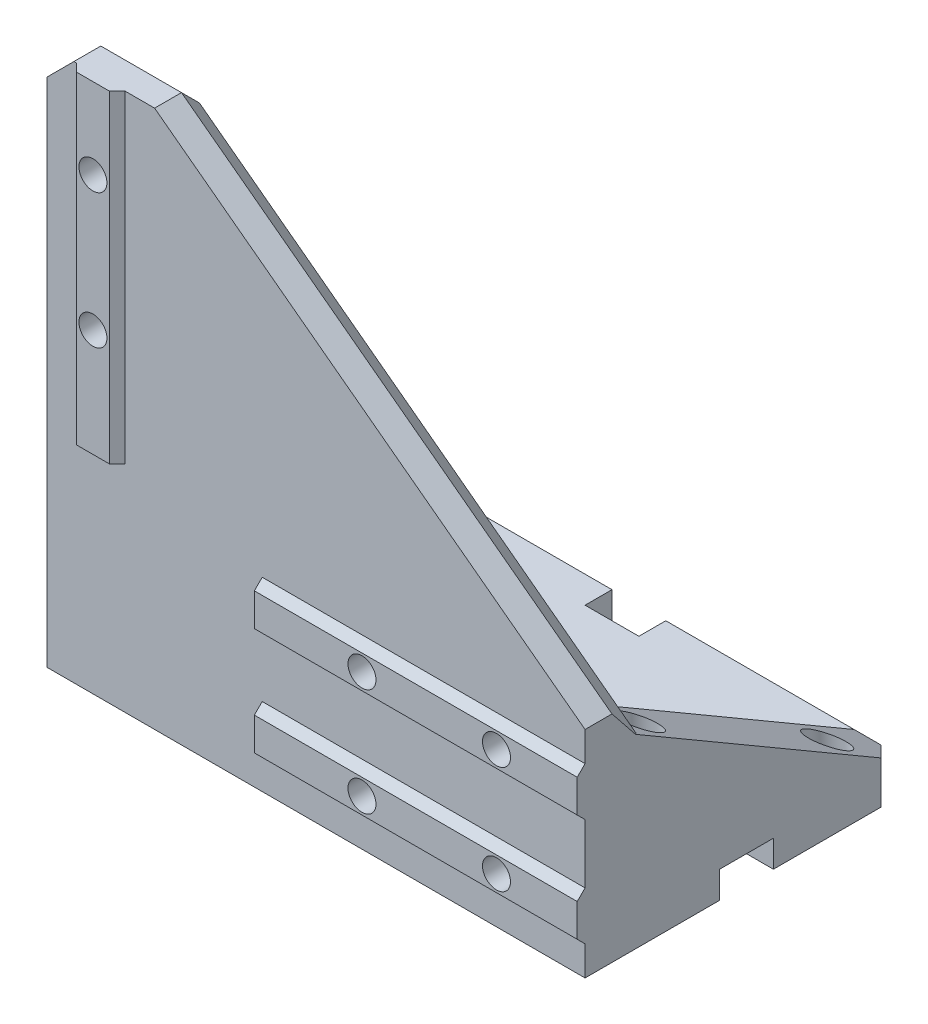
from build123d import *

# Parameters (mm, degrees)
BOSS_EXTRUDE1_DEPTH     = 10
SKETCH2_R               = 2.6
CUT_EXTRUDE1_DEPTH      = 142.774468788
BOSS_EXTRUDE3_START     = 10
SKETCH3_W               = 60
SKETCH3_H               = 9
SKETCH3_W_2             = 9
SKETCH3_H_2             = 60
BOSS_EXTRUDE3_DEPTH     = 1.46
CUT_EXTRUDE2_DEPTH      = 142.884923794
CUT_EXTRUDE2_DEPTH_BACK = 142.884923794
SKETCH2_2_R             = 2.6
CHAMFER1_SIZE           = 1.46
SKETCH4_R               = 4.5
CUT_EXTRUDE3_DEPTH      = 5
SKETCH5_W               = 100
SKETCH5_H               = 50
BOSS_EXTRUDE4_DEPTH     = 5
BOSS_EXTRUDE5_DEPTH     = 10
BOSS_EXTRUDE6_START     = 100
BOSS_EXTRUDE6_DEPTH     = 10
CUT_EXTRUDE4_DEPTH      = 151
CUT_EXTRUDE4_DEPTH_BACK = 151
SKETCH10_R              = 1.75
CUT_EXTRUDE5_START      = 100
SKETCH11_R              = 3.5
CUT_EXTRUDE5_DEPTH      = 95
SKETCH12_W              = 5
SKETCH12_H              = 10
SKETCH12_W_2            = 10
SKETCH12_H_2            = 5
CUT_EXTRUDE6_DEPTH      = 5
CHAMFER2_SIZE           = 5


# Some blends are built 0.0001 mm under size
with BuildPart() as part:
    # Sketch1 → Boss-Extrude1 (new body)
    with BuildSketch(Plane.XY):
        Polygon((0, 0), (100, 0), (100, 40), (20, 100), (0, 100), align=None)
    extrude(amount=BOSS_EXTRUDE1_DEPTH)

    # Sketch2 → Cut-Extrude1 (cut, through all)
    with BuildSketch(Plane.XY):
        with Locations((10, 85)):
            Circle(SKETCH2_R)
        with Locations((10, 60)):
            Circle(SKETCH2_R)
        with Locations((85, 30)):
            Circle(SKETCH2_R)
        with Locations((85, 10)):
            Circle(SKETCH2_R)
        with Locations((60, 10)):
            Circle(SKETCH2_R)
        with Locations((60, 30)):
            Circle(SKETCH2_R)
    extrude(amount=CUT_EXTRUDE1_DEPTH, mode=Mode.SUBTRACT)

    # Sketch3 → Boss-Extrude3 (add)
    with BuildSketch(Plane.XY.offset(BOSS_EXTRUDE3_START)):
        with Locations((70, 30)):
            Rectangle(SKETCH3_W, SKETCH3_H)
        with Locations((70, 10)):
            Rectangle(SKETCH3_W, SKETCH3_H)
        with Locations((10, 70)):
            Rectangle(SKETCH3_W_2, SKETCH3_H_2)
    extrude(amount=BOSS_EXTRUDE3_DEPTH)

    # Sketch2<2> → Cut-Extrude2 (cut, two sides: drawn at the far end of the back side and taken through both)
    with BuildSketch(Plane.XY.offset(-CUT_EXTRUDE2_DEPTH_BACK)):
        with Locations((10, 85)):
            Circle(SKETCH2_2_R)
        with Locations((10, 60)):
            Circle(SKETCH2_2_R)
        with Locations((85, 30)):
            Circle(SKETCH2_2_R)
        with Locations((85, 10)):
            Circle(SKETCH2_2_R)
        with Locations((60, 10)):
            Circle(SKETCH2_2_R)
        with Locations((60, 30)):
            Circle(SKETCH2_2_R)
    extrude(amount=CUT_EXTRUDE2_DEPTH + CUT_EXTRUDE2_DEPTH_BACK, mode=Mode.SUBTRACT)

    # Chamfer1
    chamfer1_edges = [part.edges().sort_by_distance(p)[0] for p in [
        (14.5, 70, 11.46),
        (5.5, 70, 11.46),
        (70, 5.5, 11.46),
        (70, 14.5, 11.46),
        (70, 25.5, 11.46),
        (70, 34.5, 11.46),
    ]]
    chamfer(chamfer1_edges, length=CHAMFER1_SIZE - 0.0001)  # a hair under: the kernel refuses the full size

    # Sketch4 → Cut-Extrude3 (cut)
    with BuildSketch(Plane.XY):
        with Locations((10, 85)):
            Circle(SKETCH4_R)
        with Locations((10, 60)):
            Circle(SKETCH4_R)
        with Locations((60, 30)):
            Circle(SKETCH4_R)
        with Locations((85, 30)):
            Circle(SKETCH4_R)
        with Locations((85, 10)):
            Circle(SKETCH4_R)
        with Locations((60, 10)):
            Circle(SKETCH4_R)
    extrude(amount=CUT_EXTRUDE3_DEPTH, mode=Mode.SUBTRACT)

    # Sketch5 → Boss-Extrude4 (add)
    with BuildSketch(Plane(origin=(0, 0, 0), x_dir=(1, 0, 0), z_dir=(0, 1, 0))):
        with Locations((50, 25)):
            Rectangle(SKETCH5_W, SKETCH5_H)
    extrude(amount=BOSS_EXTRUDE4_DEPTH)

    # Sketch8 → Boss-Extrude5 (add)
    with BuildSketch(Plane(origin=(0, 0, 0), x_dir=(0, 0, -1), z_dir=(1, 0, 0))):
        Polygon((-10, 5), (50, 5), (-10, 40), align=None)
    extrude(amount=BOSS_EXTRUDE5_DEPTH)

    # Sketch8<2> → Boss-Extrude6 (add)
    with BuildSketch(Plane(origin=(0, 0, 0), x_dir=(0, 0, -1), z_dir=(1, 0, 0)).offset(BOSS_EXTRUDE6_START)):
        Polygon((-10, 5), (50, 5), (-10, 40), align=None)
    extrude(amount=-BOSS_EXTRUDE6_DEPTH)

    # Sketch10 → Cut-Extrude4 (cut, two sides: drawn at the far end of the back side and taken through both)
    with BuildSketch(Plane(origin=(0, 0, 0), x_dir=(1, 0, 0), z_dir=(0, 1, 0)).offset(-CUT_EXTRUDE4_DEPTH_BACK)):
        with Locations(Location((5, 40, 0), (0, 0, 90))):
            Circle(SKETCH10_R)
        with Locations(Location((95, 40, 0), (0, 0, 90))):
            Circle(SKETCH10_R)
        with Locations(Location((95, 5, 0), (0, 0, 90))):
            Circle(SKETCH10_R)
        with Locations(Location((5, 5, 0), (0, 0, 90))):
            Circle(SKETCH10_R)
    extrude(amount=CUT_EXTRUDE4_DEPTH + CUT_EXTRUDE4_DEPTH_BACK, mode=Mode.SUBTRACT)

    # Sketch11 → Cut-Extrude5 (cut)
    with BuildSketch(Plane(origin=(0, 0, 0), x_dir=(1, 0, 0), z_dir=(0, 1, 0)).offset(CUT_EXTRUDE5_START)):
        with Locations(Location((5, 5, 0), (0, 0, 270))):
            Circle(SKETCH11_R)
        with Locations(Location((5, 40, 0), (0, 0, 270))):
            Circle(SKETCH11_R)
        with Locations(Location((95, 40, 0), (0, 0, 270))):
            Circle(SKETCH11_R)
        with Locations(Location((95, 5, 0), (0, 0, 270))):
            Circle(SKETCH11_R)
    extrude(amount=-CUT_EXTRUDE5_DEPTH, mode=Mode.SUBTRACT)

    # Sketch12 → Cut-Extrude6 (cut)
    with BuildSketch(Plane(origin=(0, 0, 0), x_dir=(1, 0, 0), z_dir=(0, 1, 0))):
        with Locations((97.5, 20)):
            Rectangle(SKETCH12_W, SKETCH12_H)
        with Locations((2.5, 20)):
            Rectangle(SKETCH12_W, SKETCH12_H)
        with Locations((50, 47.5)):
            Rectangle(SKETCH12_W_2, SKETCH12_H_2)
    extrude(amount=CUT_EXTRUDE6_DEPTH, mode=Mode.SUBTRACT)

    # Chamfer2
    # the kernel refuses this chamfer: 5 mm, written as the material it takes off along each edge
    with BuildSketch(Plane(origin=(3.333333333, 96.666666667, 3.333333333), x_dir=(0.7071067811865475, 0.7071067811865476, 0), z_dir=(-0.5773502691896258, 0.5773502691896258, -0.5773502691896258))) as chamfer2_piece_1:
        Polygon((-3.535533906, -2.041241452), (3.535533906, -2.041241452), (0, 4.082482905), align=None)
    extrude(amount=6.350852961, mode=Mode.SUBTRACT)
    with BuildSketch(Plane(origin=(100, -12.85841494, -50), x_dir=(0.0274958766105877, 0, 0.9996219169112968), z_dir=(0, 1, 0))) as chamfer2_piece_2:
        Polygon((CHAMFER2_SIZE * 0.999621916911, -CHAMFER2_SIZE * 0.0274958766106), (-CHAMFER2_SIZE * 0.0274958766106, -CHAMFER2_SIZE * 0.999621916911), (0, 0), align=None)
    extrude(amount=30.71682988, mode=Mode.SUBTRACT)
    with BuildSketch(Plane(origin=(0, -12.85841494, -50), x_dir=(-0.027495876610586372, 0, 0.9996219169112968), z_dir=(0, 1, 0))) as chamfer2_piece_3:
        Polygon((CHAMFER2_SIZE * 0.999621916911, CHAMFER2_SIZE * 0.0274958766106), (-CHAMFER2_SIZE * 0.0274958766106, CHAMFER2_SIZE * 0.999621916911), (0, 0), align=None)
    extrude(amount=30.71682988, mode=Mode.SUBTRACT)
    with BuildSketch(Plane(origin=(0, 100, -12.85841494), x_dir=(0.9996219169112968, 0.0274958766105877, 0), z_dir=(0, 0, 1))) as chamfer2_piece_4:
        Polygon((CHAMFER2_SIZE * 0.999621916911, -CHAMFER2_SIZE * 0.0274958766106), (-CHAMFER2_SIZE * 0.0274958766106, -CHAMFER2_SIZE * 0.999621916911), (0, 0), align=None)
    extrude(amount=35.71682988, mode=Mode.SUBTRACT)
    with BuildSketch(Plane(origin=(110.286731952, 32.284951036, 0), x_dir=(0.016497525966350957, 0.021996701288467948, 0.9996219169112968), z_dir=(-0.8000000000000002, 0.6, 0))) as chamfer2_piece_5_section:
        Polygon((CHAMFER2_SIZE * 0.999621916911, -CHAMFER2_SIZE * 0.0274958766106), (-CHAMFER2_SIZE * 0.0274958766106, -CHAMFER2_SIZE * 0.999621916911), (0, 0), align=None)
    chamfer2_piece_5 = extrude(amount=125.71682988, mode=Mode.PRIVATE)
    chamfer2_piece_5 = split(chamfer2_piece_5, bisect_by=Plane(origin=(58.587038142, 43.71482671, 16.368274359), z_dir=(0, 0.8637789008984335, -0.5038710255240861)), keep=Keep.TOP, mode=Mode.PRIVATE)
    add(chamfer2_piece_5, mode=Mode.SUBTRACT)
    with BuildSketch(Plane(origin=(32.85841494, 100, 0), x_dir=(0, 0.0274958766105877, 0.9996219169112968), z_dir=(-1, 0, 0))) as chamfer2_piece_6:
        Polygon((CHAMFER2_SIZE * 0.999621916911, -CHAMFER2_SIZE * 0.0274958766106), (-CHAMFER2_SIZE * 0.0274958766106, -CHAMFER2_SIZE * 0.999621916911), (0, 0), align=None)
    extrude(amount=45.71682988, mode=Mode.SUBTRACT)
    with BuildSketch(Plane(origin=(0, 112.85841494, 0), x_dir=(-0.02749587661058638, 0, 0.9996219169112968), z_dir=(0, -1, 0))) as chamfer2_piece_7_section:
        Polygon((CHAMFER2_SIZE * 0.999621916911, -CHAMFER2_SIZE * 0.0274958766106), (-CHAMFER2_SIZE * 0.0274958766106, -CHAMFER2_SIZE * 0.999621916911), (0, 0), align=None)
    chamfer2_piece_7 = extrude(amount=91.550163213, mode=Mode.PRIVATE)
    chamfer2_piece_7 = split(chamfer2_piece_7, bisect_by=Plane(origin=(1.672912206, 43.366191756, 15.770614439), z_dir=(0, 0.8637789008984335, -0.5038710255240861)), keep=Keep.TOP, mode=Mode.PRIVATE)
    add(chamfer2_piece_7, mode=Mode.SUBTRACT)


solid = part.part
